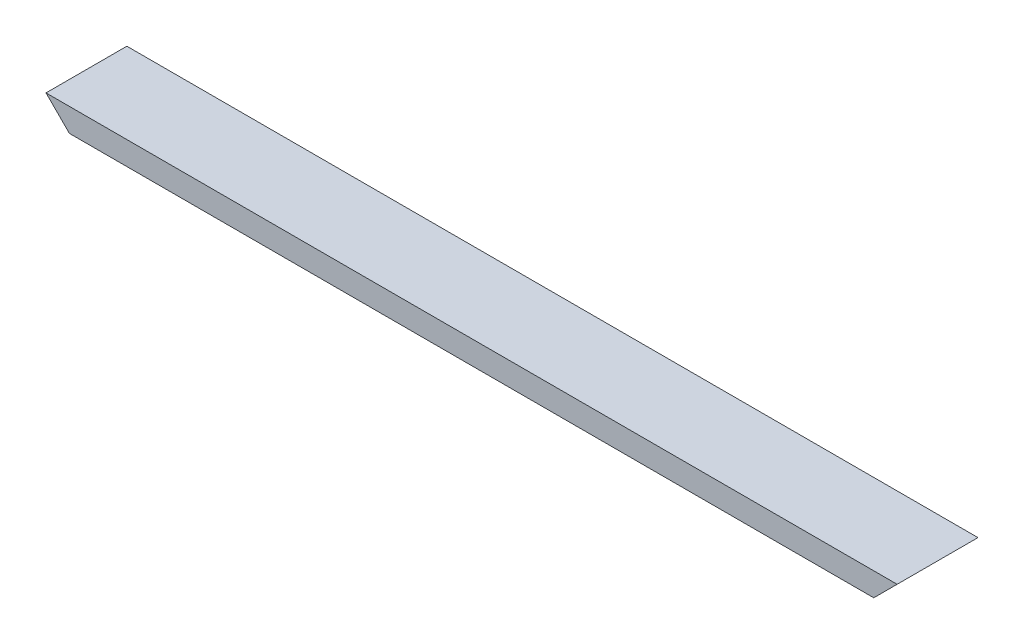
from build123d import *

# Parameters (mm, degrees)
SKETCH1_W               = 38
SKETCH1_H               = 11
SKETCH1_W_2             = 35
SKETCH1_H_2             = 8
BOSS_EXTRUDE1_DEPTH     = 400
CUT_EXTRUDE1_DEPTH      = 402.838586997
CUT_EXTRUDE1_DEPTH_BACK = 402.838586997
CUT_EXTRUDE3_DEPTH      = 402.838586997
CUT_EXTRUDE3_DEPTH_BACK = 402.838586997


with BuildPart() as part:
    # Sketch1 → Boss-Extrude1 (new body)
    with BuildSketch(Plane(origin=(0, 0, 0), x_dir=(0, 0, -1), z_dir=(1, 0, 0))):
        Rectangle(SKETCH1_W, SKETCH1_H)
        Rectangle(SKETCH1_W_2, SKETCH1_H_2, mode=Mode.SUBTRACT)
    extrude(amount=BOSS_EXTRUDE1_DEPTH)

    # Sketch2 → Cut-Extrude1 (cut, two sides: drawn at the far end of the back side and taken through both)
    with BuildSketch(Plane(origin=(0, 0, -19), x_dir=(-1, 0, 0), z_dir=(0, 0, -1)).offset(-CUT_EXTRUDE1_DEPTH_BACK)):
        Polygon((572.970352137, 578.470352137), (0, 5.5), (-11, -5.5), (-583.970352137, -578.470352137), (561.970352137, -1724.411056412), (1718.911056412, -567.470352137), align=None)
    extrude(amount=CUT_EXTRUDE1_DEPTH + CUT_EXTRUDE1_DEPTH_BACK, mode=Mode.SUBTRACT)

    # Sketch3 → Cut-Extrude3 (cut, two sides: drawn at the far end of the back side and taken through both)
    with BuildSketch(Plane(origin=(0, 0, -19), x_dir=(-1, 0, 0), z_dir=(0, 0, -1)).offset(-CUT_EXTRUDE3_DEPTH_BACK)):
        Polygon((-972.970352137, 578.470352137), (-400, 5.5), (-389, -5.5), (183.970352137, -578.470352137), (-961.970352137, -1724.411056412), (-2118.911056412, -567.470352137), align=None)
    extrude(amount=CUT_EXTRUDE3_DEPTH + CUT_EXTRUDE3_DEPTH_BACK, mode=Mode.SUBTRACT)


solid = part.part
